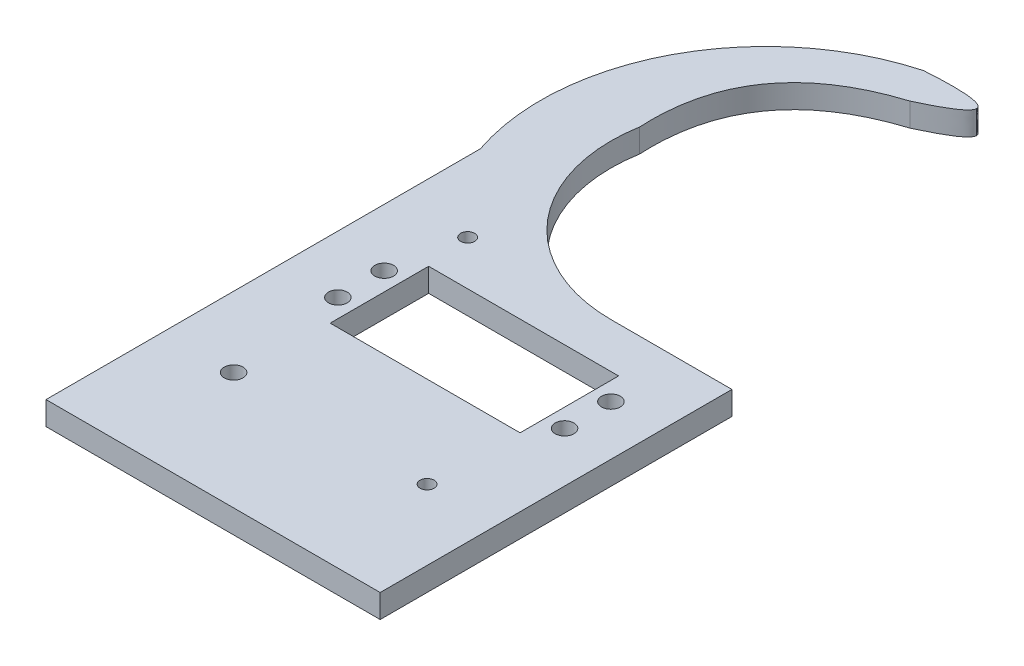
from build123d import *

# Parameters (mm, degrees)
BOSS_EXTRUDE1_DEPTH = 2.5
SKETCH2_W           = 39
SKETCH2_H           = 19
CUT_EXTRUDE2_DEPTH  = 119.291735722
SKETCH6_R           = 1.5
SKETCH6_R_2         = 2
CUT_EXTRUDE11_DEPTH = 119.291735722
SKETCH8_W           = 39.164697568
SKETCH8_H           = 2
CUT_EXTRUDE12_DEPTH = 10
SKETCH9_W           = 40.5
SKETCH9_H           = 21
CUT_EXTRUDE14_DEPTH = 10
CUT_EXTRUDE17_DEPTH = 10
SKETCH10_R          = 2
CUT_EXTRUDE16_DEPTH = 10
CUT_EXTRUDE23_DEPTH = 10


with BuildPart() as part:
    # Sketch1 → Boss-Extrude1 (new, symmetric)
    with BuildSketch(Plane(origin=(0, 0, 0), x_dir=(1, 0, 0), z_dir=(0, 1, 0))):
        with BuildLine():
            Line((0, 33), (0, 48))
            ThreePointArc((0, 48), (-39.003855832, 27.976762325), (-45.466733516, -15.387532074))
            Line((-45.466733516, -15.387532074), (-45.466733516, -107.999697871))
            Line((-45.466733516, -107.999697871), (25.786244138, -107.999697871))
            Line((25.786244138, -107.999697871), (25.786244138, -33))
            Line((25.786244138, -33), (0, -33))
            ThreePointArc((0, -33), (-33, 0), (0, 33))
        make_face()
        with BuildLine():
            Line((-7.096269411, -47.472549547), (0, -47.472549547))
            Line((0, -47.472549547), (0, -48))
            ThreePointArc((0, -48), (-3.55792227, -47.867955765), (-7.096269411, -47.472549547))
        make_face(mode=Mode.SUBTRACT)
    extrude(amount=BOSS_EXTRUDE1_DEPTH, both=True)

    # Sketch2 → Cut-Extrude2 (cut, through all)
    with BuildSketch(Plane(origin=(0, 2.5, 0), x_dir=(1, 0, 0), z_dir=(0, 1, 0))):
        with Locations((-9.786245396, -52.095481266)):
            Rectangle(SKETCH2_W, SKETCH2_H)
    extrude(amount=-CUT_EXTRUDE2_DEPTH, mode=Mode.SUBTRACT)

    # Sketch6 → Cut-Extrude11 (cut, through all)
    with BuildSketch(Plane(origin=(0, 2.5, 0), x_dir=(1, 0, 0), z_dir=(0, 1, 0))):
        with Locations((10.786244138, -82.999697871)):
            Circle(SKETCH6_R)
        with Locations((-30.466733516, -82.999697871)):
            Circle(SKETCH6_R_2)
        with Locations((-30.466733516, -33.095481266)):
            Circle(SKETCH6_R)
    extrude(amount=-CUT_EXTRUDE11_DEPTH, mode=Mode.SUBTRACT)

    # Sketch8 → Cut-Extrude12 (cut)
    with BuildSketch(Plane(origin=(0, 2.5, 0), x_dir=(1, 0, 0), z_dir=(0, 1, 0))):
        with Locations((-9.703896612, -62.595481266)):
            Rectangle(SKETCH8_W, SKETCH8_H)
    extrude(amount=-CUT_EXTRUDE12_DEPTH, mode=Mode.SUBTRACT)

    # Sketch9 → Cut-Extrude14 (cut)
    with BuildSketch(Plane(origin=(0, 2.5, 0), x_dir=(1, 0, 0), z_dir=(0, 1, 0))):
        with Locations((-9.036245396, -53.095481266)):
            Rectangle(SKETCH9_W, SKETCH9_H)
    extrude(amount=-CUT_EXTRUDE14_DEPTH, mode=Mode.SUBTRACT)

    # Sketch11 → Cut-Extrude17 (cut)
    with BuildSketch(Plane(origin=(0, 2.5, 0), x_dir=(1, 0, 0), z_dir=(0, 1, 0))):
        with BuildLine():
            Line((-8.49120153, 39.220810677), (-8.49120153, 31.888861638))
            Line((-8.49120153, 31.888861638), (-32.514043682, 5.642425314))
            add(Edge.make_bspline(
                [(-32.514043682, 5.642425314), (-33.882768602, 31.207106787), (-8.49120153, 39.220810677)],
                knots=[0, 0, 0, 1, 1, 1], degree=2))
        make_face()
    extrude(amount=-CUT_EXTRUDE17_DEPTH, mode=Mode.SUBTRACT)

    # Sketch10 → Cut-Extrude16 (cut)
    with BuildSketch(Plane(origin=(0, 2.5, 0), x_dir=(1, 0, 0), z_dir=(0, 1, 0))):
        with Locations((-33.206245396, -48.155481266)):
            Circle(SKETCH10_R)
        with Locations((-33.206245396, -58.035481266)):
            Circle(SKETCH10_R)
        with Locations((15.133754604, -58.035481266)):
            Circle(SKETCH10_R)
        with Locations((15.133754604, -48.155481266)):
            Circle(SKETCH10_R)
    extrude(amount=-CUT_EXTRUDE16_DEPTH, mode=Mode.SUBTRACT)

    # Sketch16 → Cut-Extrude23 (cut)
    with BuildSketch(Plane(origin=(0, 2.5, 0), x_dir=(1, 0, 0), z_dir=(0, 1, 0))):
        with BuildLine():
            add(Edge.make_bspline(
                [(-12.673752424, 46.296608942), (10.376290114, 47.869172406), (-8.49120153, 39.220810677)],
                knots=[0.455550409, 0.455550409, 0.455550409, 1.455550409, 1.455550409, 1.455550409], degree=2))
            Line((-8.49120153, 39.220810677), (-12.263458329, 30.819233376))
            Line((-12.263458329, 30.819233376), (3.120191492, 30.819233376))
            Line((3.120191492, 30.819233376), (5.295657124, 36.568678259))
            Line((5.295657124, 36.568678259), (6.616475543, 45.503626387))
            Line((6.616475543, 45.503626387), (1.993611076, 53.894708108))
            Line((1.993611076, 53.894708108), (-14.089295555, 56.847125751))
            Line((-14.089295555, 56.847125751), (-12.673752424, 46.296608942))
        make_face()
    extrude(amount=-CUT_EXTRUDE23_DEPTH, mode=Mode.SUBTRACT)


solid = part.part
